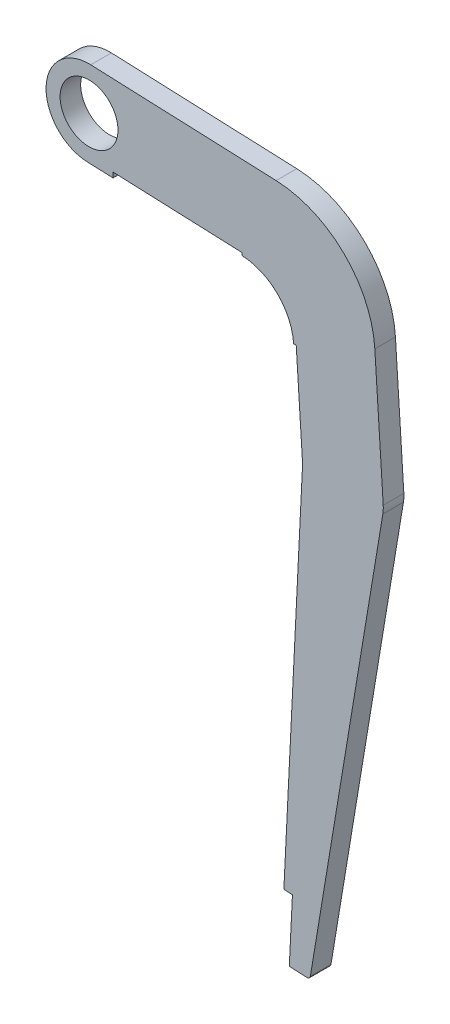
from build123d import *

# Parameters (mm, degrees)
SKETCH_1_R               = 16.85
EXTRUDE_1_DEPTH          = 12
FILLET_1_R               = 30
FILLET_2_R               = 60
CUT_EXTRUDE_1_DEPTH      = 410.990466147
CUT_EXTRUDE_1_DEPTH_BACK = 410.990466147
FILLET_3_R               = 2
FILLET_4_R               = 20
CUT_EXTRUDE_2_DEPTH      = 410.868383554
CUT_EXTRUDE_2_DEPTH_BACK = 410.868383554
EXTRUDE_START            = -12
EXTRUDE_2_DEPTH          = 12


with BuildPart() as part:
    # Sketch 1 → Бобышка-Вытянуть1 (new body)
    with BuildSketch(Plane.XY):
        with BuildLine():
            Line((-1.020104874, -24.979179051), (115.882453083, -29.75326986))
            Line((115.882453083, -29.75326986), (121.310616212, -114.579769523))
            Line((121.310616212, -114.579769523), (108.583485608, -371.264440173))
            Line((108.583485608, -371.264440173), (128.558946359, -372.254878352))
            Line((128.558946359, -372.254878352), (171.389870978, -114.220142814))
            Line((171.389870978, -114.220142814), (162.905370512, 18.368075133))
            Line((162.905370512, 18.368075133), (1.020104874, 24.979179051))
            ThreePointArc((1.020104874, 24.979179051), (-24.979179051, 1.020104874), (-1.020104874, -24.979179051))
        make_face()
        Circle(SKETCH_1_R, mode=Mode.SUBTRACT)
    extrude(amount=EXTRUDE_1_DEPTH)

    # Скругление1
    fillet_1_edges = [part.edges().sort_by_distance(p)[0] for p in [
        (115.882453083, -29.75326986, 6),
    ]]
    fillet(fillet_1_edges, radius=FILLET_1_R)

    # Скругление2
    fillet_2_edges = [part.edges().sort_by_distance(p)[0] for p in [
        (162.905370512, 18.368075133, 6),
    ]]
    fillet(fillet_2_edges, radius=FILLET_2_R)

    # Sketch 2 → Вырез-Вытянуть1 (cut, two sides: drawn at the far end of the back side and taken through both)
    with BuildSketch(Plane(origin=(0, 0, 0), x_dir=(-1, 0, 0), z_dir=(0, 0, -1)).offset(-CUT_EXTRUDE_1_DEPTH_BACK)):
        Polygon((-108.583485608, -371.264440173), (-116.573669908, -371.660615445), (-118.40598054, -334.706013056), (-110.41579624, -334.309837784), align=None)
    extrude(amount=CUT_EXTRUDE_1_DEPTH + CUT_EXTRUDE_1_DEPTH_BACK, mode=Mode.SUBTRACT)

    # Скругление3
    fillet_3_edges = [part.edges().sort_by_distance(p)[0] for p in [
        (128.558946359, -372.254878352, 6),
    ]]
    fillet(fillet_3_edges, radius=FILLET_3_R)

    # Скругление4
    fillet_4_edges = [part.edges().sort_by_distance(p)[0] for p in [
        (171.389870978, -114.220142814, 6),
    ]]
    fillet(fillet_4_edges, radius=FILLET_4_R)

    # Эскиз3 → Вырез-Вытянуть2 (cut, two sides: drawn at the far end of the back side and taken through both)
    with BuildSketch(Plane.XY.offset(12).offset(-CUT_EXTRUDE_2_DEPTH_BACK)):
        with BuildLine():
            Line((13.955291323, -25.590747374), (88.892828475, -28.651061996))
            ThreePointArc((88.892828475, -28.651061996), (108.635605286, -37.16939974), (117.607467213, -56.710254576))
            Line((117.607467213, -56.710254576), (121.310616212, -114.579769523))
            Line((121.310616212, -114.579769523), (110.41579624, -334.309837784))
            Line((110.41579624, -334.309837784), (113.412115352, -334.458403511))
            Line((113.412115352, -334.458403511), (124.315371498, -114.558191921))
            Line((124.315371498, -114.558191921), (120.601343672, -56.518672348))
            ThreePointArc((120.601343672, -56.518672348), (110.732295552, -35.023732029), (89.01524106, -25.65356051))
            Line((89.01524106, -25.65356051), (13.955291323, -22.588246777))
            Line((13.955291323, -22.588246777), (13.955291323, -25.590747374))
        make_face()
    extrude(amount=CUT_EXTRUDE_2_DEPTH + CUT_EXTRUDE_2_DEPTH_BACK, mode=Mode.SUBTRACT)

    # Эскиз4 → Бобышка-Вытянуть2 (add)
    with BuildSketch(Plane.XY.offset(12).offset(EXTRUDE_START)):
        with BuildLine():
            Line((120.601343672, -56.518672348), (119.104405442, -56.614463462))
            ThreePointArc((119.104405442, -56.614463462), (109.683950419, -36.096565885), (88.954034767, -27.152311253))
            Line((88.954034767, -27.152311253), (89.01524106, -25.65356051))
            ThreePointArc((89.01524106, -25.65356051), (110.732295552, -35.023732029), (120.601343672, -56.518672348))
        make_face()
    extrude(amount=EXTRUDE_2_DEPTH)


solid = part.part
